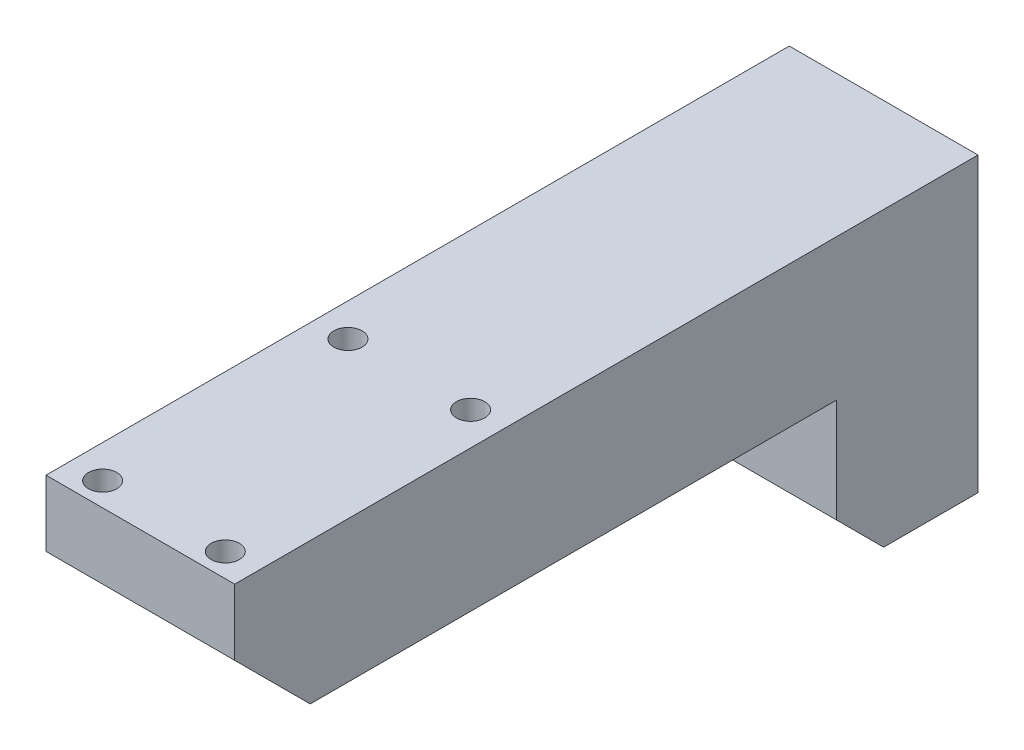
from build123d import *

# Parameters (mm, degrees)
SZKIC1_W                       = 40
SZKIC1_H                       = 157.55
DODANIE_WYCI_GNI_CIE1_DEPTH    = 30
SZKIC2_W                       = 40
SZKIC2_H                       = 30
DODANIE_WYCI_GNI_CIE2_DEPTH    = 32
SZKIC3_R                       = 3
WYTNIJ_WYCI_GNI_CIE1_DEPTH     = 30
SFAZOWANIE1_SIZE               = 16
SZKIC4_R                       = 5.5
WYTNIJ_WYCI_GNI_CIE7_DEPTH     = 15
SFAZOWANIE2_SIZE               = 10
OTW_R_GWINTOWANY_M8X1_01_D     = 7
OTW_R_GWINTOWANY_M8X1_01_DEPTH = 21
OTW_R_GWINTOWANY_M8X1_01_TIP   = 2.103012167


with BuildPart() as part:
    # Szkic1 → Dodanie-wyciągnięcie1 (new body)
    with BuildSketch(Plane(origin=(0, 0, 0), x_dir=(1, 0, 0), z_dir=(0, 1, 0))):
        Rectangle(SZKIC1_W, SZKIC1_H)
    extrude(amount=DODANIE_WYCI_GNI_CIE1_DEPTH)

    # Szkic2 → Dodanie-wyciągnięcie2 (add)
    with BuildSketch(Plane(origin=(0, 0, 0), x_dir=(-1, 0, 0), z_dir=(0, -1, 0))):
        with Locations((0, 63.775)):
            Rectangle(SZKIC2_W, SZKIC2_H)
    extrude(amount=DODANIE_WYCI_GNI_CIE2_DEPTH)

    # Szkic3 → Wytnij-wyciągnięcie1 (cut)
    with BuildSketch(Plane(origin=(0, 30, 0), x_dir=(1, 0, 0), z_dir=(0, 1, 0))):
        with Locations(Location((-13, -73.775, 0), (0, 0, 270))):
            Circle(SZKIC3_R)
        with Locations(Location((13, -73.775, 0), (0, 0, 270))):
            Circle(SZKIC3_R)
        with Locations(Location((13, -21.775, 0), (0, 0, 270))):
            Circle(SZKIC3_R)
        with Locations(Location((-13, -21.775, 0), (0, 0, 270))):
            Circle(SZKIC3_R)
    extrude(amount=-WYTNIJ_WYCI_GNI_CIE1_DEPTH, mode=Mode.SUBTRACT)

    # Sfazowanie1
    # the kernel refuses this chamfer: 16 mm, written as the material it takes off along each edge
    with BuildSketch(Plane(origin=(61.146927807, 0, 78.775), x_dir=(0, 0.9996219169112968, 0.027495876610586494), z_dir=(-1, 0, 0))) as sfazowanie1_piece_1:
        Polygon((SFAZOWANIE1_SIZE * 0.999621916911, SFAZOWANIE1_SIZE * 0.0274958766106), (-SFAZOWANIE1_SIZE * 0.0274958766106, SFAZOWANIE1_SIZE * 0.999621916911), (0, 0), align=None)
    extrude(amount=122.293855615, mode=Mode.SUBTRACT)

    # Szkic4 → Wytnij-wyciągnięcie7 (cut)
    with BuildSketch(Plane.XZ):
        with Locations((13, 73.775)):
            Circle(SZKIC4_R)
        with Locations((-13, 73.775)):
            Circle(SZKIC4_R)
    extrude(amount=-WYTNIJ_WYCI_GNI_CIE7_DEPTH, mode=Mode.SUBTRACT)

    # Sfazowanie2
    sfazowanie2_edges = [part.edges().sort_by_distance(p)[0] for p in [
        (0, -32, -48.775),
    ]]
    chamfer(sfazowanie2_edges, length=SFAZOWANIE2_SIZE)

    # Otwór gwintowany M8x1.01
    with Locations(Plane(origin=(0, 0, -78.775), x_dir=(-1, 0, 0), z_dir=(0, 0, -1))):
        with Locations((-13, -25), (-13, 23), (13, 23), (13, -25)):
            Hole(OTW_R_GWINTOWANY_M8X1_01_D / 2, depth=OTW_R_GWINTOWANY_M8X1_01_DEPTH)
            with Locations((0, 0, -(OTW_R_GWINTOWANY_M8X1_01_DEPTH + OTW_R_GWINTOWANY_M8X1_01_TIP / 2))):  # 118° drill point
                Cone(0, OTW_R_GWINTOWANY_M8X1_01_D / 2, OTW_R_GWINTOWANY_M8X1_01_TIP, mode=Mode.SUBTRACT)


solid = part.part
